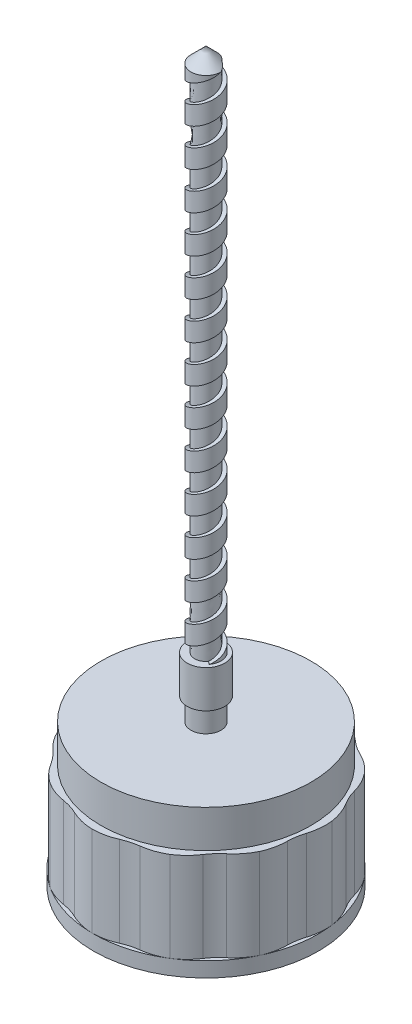
from build123d import *

# Parameters (mm, degrees)
SKETCH1_R           = 15
BOSS_EXTRUDE1_DEPTH = 14
CUT_EXTRUDE1_START  = -12
CUT_EXTRUDE1_DEPTH  = 12
CIRPATTERN1_COUNT   = 11
SKETCH5_R           = 14
BOSS_EXTRUDE2_DEPTH = 5
SKETCH6_R           = 2
BOSS_EXTRUDE3_DEPTH = 3
SKETCH7_R           = 2.5
BOSS_EXTRUDE4_DEPTH = 5
SKETCH9_R           = 2
BOSS_EXTRUDE5_DEPTH = 70
CHAMFER1_SIZE       = 2
CUT_SWEEP1_PITCH    = 5
CUT_SWEEP1_TO       = 70
SKETCH12_R          = 14
CUT_EXTRUDE2_DEPTH  = 13
SCALE1_SCALE        = 0.655


with BuildPart() as part:
    # Sketch1 → Boss-Extrude1 (new body)
    with BuildSketch(Plane(origin=(0, 0, 0), x_dir=(1, 0, 0), z_dir=(0, 1, 0))):
        with Locations(Location((0, 0, 0), (0, 0, 270))):
            Circle(SKETCH1_R)
    extrude(amount=BOSS_EXTRUDE1_DEPTH)

    # Sketch4 → Cut-Extrude1 (cut)
    with BuildSketch(Plane(origin=(0, 14, 0), x_dir=(1, 0, 0), z_dir=(0, 1, 0)).offset(CUT_EXTRUDE1_START)):
        with BuildLine():
            ThreePointArc((12.911938156, 6.867084757), (13.281339956, 5.818591665), (13.801666075, 4.836218932))
            ThreePointArc((13.801666075, 4.836218932), (14.530369604, 3.324432688), (14.90466719, 1.688459644))
            ThreePointArc((14.90466719, 1.688459644), (13.739317196, 6.019232757), (11.345755514, 9.811922941))
            ThreePointArc((11.345755514, 9.811922941), (12.294626372, 8.427672033), (12.911938156, 6.867084757))
        make_face()
    cut_extrude1 = extrude(amount=CUT_EXTRUDE1_DEPTH, mode=Mode.SUBTRACT)

    # CirPattern1: Cut-Extrude1 ×11 about axis
    cirpattern1_axis = Axis((0, 0, 0), (0, 1, 0))
    for i in range(1, CIRPATTERN1_COUNT):
        add(cut_extrude1.rotate(cirpattern1_axis, i * 360 / CIRPATTERN1_COUNT), mode=Mode.SUBTRACT)

    # Sketch5 → Boss-Extrude2 (add)
    with BuildSketch(Plane(origin=(0, 14, 0), x_dir=(1, 0, 0), z_dir=(0, 1, 0))):
        with Locations(Location((0, 0, 0), (0, 0, 270))):
            Circle(SKETCH5_R)
    extrude(amount=BOSS_EXTRUDE2_DEPTH)

    # Sketch6 → Boss-Extrude3 (add)
    with BuildSketch(Plane(origin=(0, 19, 0), x_dir=(1, 0, 0), z_dir=(0, 1, 0))):
        with Locations(Location((0, 0, 0), (0, 0, 270))):
            Circle(SKETCH6_R)
    extrude(amount=BOSS_EXTRUDE3_DEPTH)

    # Sketch7 → Boss-Extrude4 (add)
    with BuildSketch(Plane(origin=(0, 22, 0), x_dir=(1, 0, 0), z_dir=(0, 1, 0))):
        with Locations(Location((0, 0, 0), (0, 0, 270))):
            Circle(SKETCH7_R)
    extrude(amount=BOSS_EXTRUDE4_DEPTH)

    # Sketch9 → Boss-Extrude5 (add)
    with BuildSketch(Plane(origin=(0, 27, 0), x_dir=(1, 0, 0), z_dir=(0, 1, 0))):
        with Locations(Location((0, 0, 0), (0, 0, 270))):
            Circle(SKETCH9_R)
    extrude(amount=BOSS_EXTRUDE5_DEPTH)

    # Chamfer1
    chamfer1_edges = [part.edges().sort_by_distance(p)[0] for p in [
        (0, 97, -2),
    ]]
    chamfer(chamfer1_edges, length=CHAMFER1_SIZE)

    # Cut-Sweep1: arcs per turn and ends read off the stored shape
    # Cut-Sweep1: the profile of Sketch11 profile screwed along a right-hand helix through 14.5 turns, 12 arcs to a turn; built about Z, then put on its axis
    cut_sweep1_z = Axis((0, 0, 0), (0, 0, 1))
    cut_sweep1_corners = [(2.0003, 0, 2), (1.5, 0, 2), (1.5, 0, -0.5), (2.0003, 0, -0.5)]
    with BuildLine(mode=Mode.PRIVATE) as cut_sweep1_profile:
        Line(cut_sweep1_corners[0], cut_sweep1_corners[1])
        Line(cut_sweep1_corners[1], cut_sweep1_corners[2])
        Line(cut_sweep1_corners[2], cut_sweep1_corners[3])
        Line(cut_sweep1_corners[3], cut_sweep1_corners[0])
    cut_sweep1_cap = Face(cut_sweep1_profile.wire())
    cut_sweep1_turn_angles = [0, 15, 30, 45, 60, 75, 90, 105, 120, 135, 150, 165, 180, 195, 210, 225, 240, 255, 270, 285, 300, 315, 330, 345, 360]
    cut_sweep1_turn_weights = [1, 0.9659258262890683, 1, 0.9659258262890683, 1, 0.9659258262890683, 1, 0.9659258262890683, 1, 0.9659258262890683, 1, 0.9659258262890683, 1, 0.9659258262890683, 1, 0.9659258262890683, 1, 0.9659258262890683, 1, 0.9659258262890683, 1, 0.9659258262890683, 1, 0.9659258262890683, 1]
    cut_sweep1_turn_rails = [Edge.make_bspline([Vector(p[0], p[1], 0).rotate(cut_sweep1_z, cut_sweep1_turn_angles[k]) / cut_sweep1_turn_weights[k] + Vector(0, 0, p[2] + CUT_SWEEP1_PITCH * cut_sweep1_turn_angles[k] / 360) for k in range(25)], [0, 0, 0, 1, 1, 2, 2, 3, 3, 4, 4, 5, 5, 6, 6, 7, 7, 8, 8, 9, 9, 10, 10, 11, 11, 12, 12, 12], 2, cut_sweep1_turn_weights) for p in cut_sweep1_corners]
    cut_sweep1_turn_sides = [Face.make_surface_from_curves(cut_sweep1_turn_rails[p[0]], cut_sweep1_turn_rails[p[1]]) for p in [(0, 1), (1, 2), (2, 3), (3, 0)]]
    cut_sweep1_last_angles = [5040, 5055, 5070, 5085, 5100, 5115, 5130, 5145, 5160, 5175, 5190, 5205, 5220]
    cut_sweep1_last_weights = [1, 0.9659258262890683, 1, 0.9659258262890683, 1, 0.9659258262890683, 1, 0.9659258262890683, 1, 0.9659258262890683, 1, 0.9659258262890683, 1]
    cut_sweep1_last_rails = [Edge.make_bspline([Vector(p[0], p[1], 0).rotate(cut_sweep1_z, cut_sweep1_last_angles[k]) / cut_sweep1_last_weights[k] + Vector(0, 0, p[2] + CUT_SWEEP1_PITCH * cut_sweep1_last_angles[k] / 360) for k in range(13)], [0, 0, 0, 1, 1, 2, 2, 3, 3, 4, 4, 5, 5, 6, 6, 6], 2, cut_sweep1_last_weights) for p in cut_sweep1_corners]
    cut_sweep1_last_sides = [Face.make_surface_from_curves(cut_sweep1_last_rails[p[0]], cut_sweep1_last_rails[p[1]]) for p in [(0, 1), (1, 2), (2, 3), (3, 0)]]
    cut_sweep1 = Plane(origin=(0, 97, 0), x_dir=(-1, 0, 0), z_dir=(0, -1, 0)) * split(Solid(Shell([*[p.moved(Location((0, 0, CUT_SWEEP1_PITCH * i))) for i in range(14) for p in cut_sweep1_turn_sides], *cut_sweep1_last_sides, cut_sweep1_cap, cut_sweep1_cap.rotate(cut_sweep1_z, 5220).moved(Location((0, 0, CUT_SWEEP1_PITCH * 5220 / 360)))])), bisect_by=Plane.XY.offset(CUT_SWEEP1_TO), keep=Keep.BOTTOM, mode=Mode.PRIVATE)
    add(cut_sweep1, mode=Mode.SUBTRACT)

    # Sketch12 → Cut-Extrude2 (cut)
    with BuildSketch(Plane.XZ):
        with Locations(Location((0, 0, 0), (0, 0, 90))):
            Circle(SKETCH12_R)
    extrude(amount=-CUT_EXTRUDE2_DEPTH, mode=Mode.SUBTRACT)


with BuildPart() as part_1:
    # Scale1: scaled about (0, 0, 0)
    add(part.part.scale(SCALE1_SCALE))


solid = part_1.part
